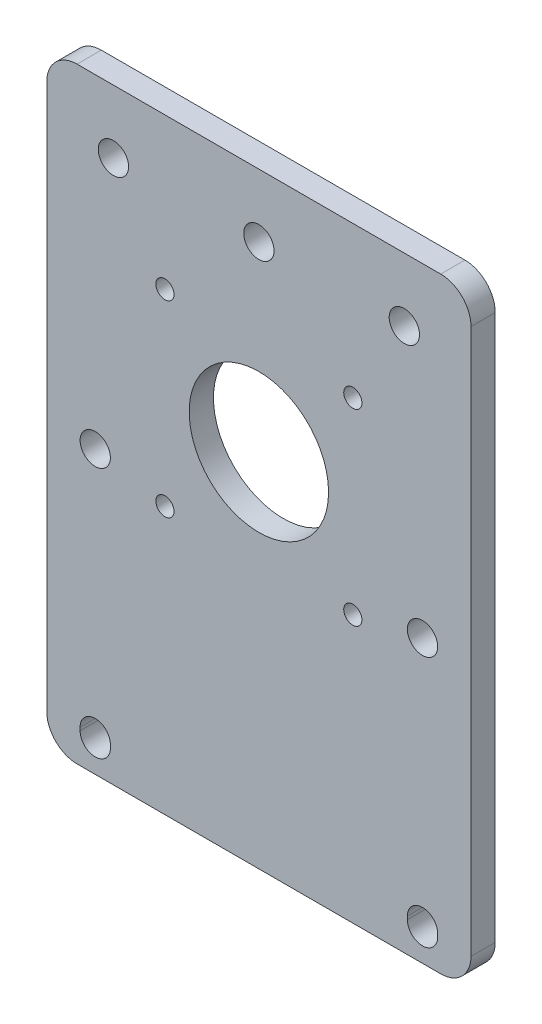
from build123d import *

# Parameters (mm, degrees)
SKETCH4_W           = 70
SKETCH4_H           = 100
SKETCH4_R           = 2.5
BOSS_EXTRUDE2_DEPTH = 4
SKETCH5_R           = 11.5
SKETCH5_R_2         = 1.5
CUT_EXTRUDE2_DEPTH  = 62.163714733
SKETCH6_R           = 2.5
CUT_EXTRUDE3_DEPTH  = 62.163714733
FILLET1_R           = 5


with BuildPart() as part:
    # Sketch4 → Boss-Extrude2 (new body)
    with BuildSketch(Plane.XY):
        Rectangle(SKETCH4_W, SKETCH4_H)
        with Locations((-27, -3.5)):
            Circle(SKETCH4_R, mode=Mode.SUBTRACT)
        with Locations((27, -3.5)):
            Circle(SKETCH4_R, mode=Mode.SUBTRACT)
        with BuildLine():
            Line((-24.5, -44.5), (-24.5, -45))
            ThreePointArc((-24.5, -45), (-27, -47.5), (-29.5, -45))
            Line((-29.5, -45), (-29.5, -44.5))
            ThreePointArc((-29.5, -44.5), (-27, -42), (-24.5, -44.5))
        make_face(mode=Mode.SUBTRACT)
        with BuildLine():
            Line((24.5, -44.5), (24.5, -45))
            ThreePointArc((24.5, -45), (27, -47.5), (29.5, -45))
            Line((29.5, -45), (29.5, -44.5))
            ThreePointArc((29.5, -44.5), (27, -42), (24.5, -44.5))
        make_face(mode=Mode.SUBTRACT)
    extrude(amount=BOSS_EXTRUDE2_DEPTH)

    # Sketch5 → Cut-Extrude2 (cut, through all)
    with BuildSketch(Plane.XY.offset(4)):
        with Locations((0, 9.576696831)):
            Circle(SKETCH5_R)
        with Locations((-15.5, 25.076696831)):
            Circle(SKETCH5_R_2)
        with Locations((15.5, 25.076696831)):
            Circle(SKETCH5_R_2)
        with Locations((15.5, -5.923303169)):
            Circle(SKETCH5_R_2)
        with Locations((-15.5, -5.923303169)):
            Circle(SKETCH5_R_2)
    extrude(amount=-CUT_EXTRUDE2_DEPTH, mode=Mode.SUBTRACT)

    # Sketch6 → Cut-Extrude3 (cut, through all)
    with BuildSketch(Plane.XY.offset(4)):
        with Locations((24, 39.576696831)):
            Circle(SKETCH6_R)
        with Locations((-24, 39.576696831)):
            Circle(SKETCH6_R)
        with Locations((0, 39.576696831)):
            Circle(SKETCH6_R)
    extrude(amount=-CUT_EXTRUDE3_DEPTH, mode=Mode.SUBTRACT)

    # Fillet1
    fillet1_edges = [part.edges().sort_by_distance(p)[0] for p in [
        (-35, -50, 2),
        (35, -50, 2),
        (35, 50, 2),
        (-35, 50, 2),
    ]]
    fillet(fillet1_edges, radius=FILLET1_R)


solid = part.part
